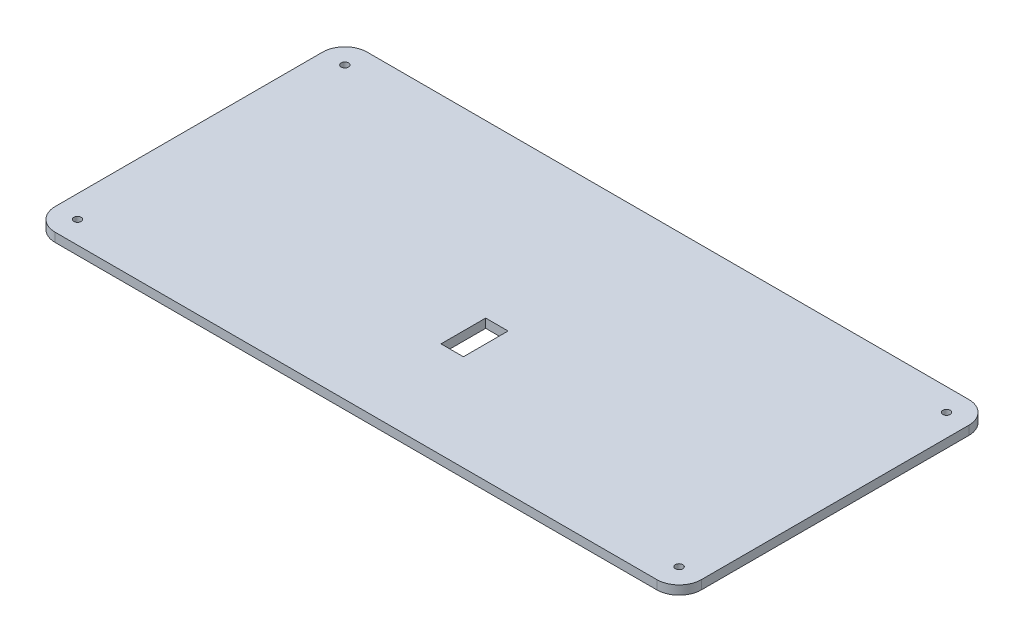
from build123d import *

# Parameters (mm, degrees)
SKETCH1_R               = 1.65
BOSS_EXTRUDE1_DEPTH     = 4
MIRROR2_COPY_1_SKETCH_R = 1.65
MIRROR2_COPY_1_DEPTH    = 4
MIRROR2_COPY_2_SKETCH_R = 1.65
MIRROR2_COPY_2_DEPTH    = 4
SKETCH2_W               = 10.05
SKETCH2_H               = 20.05
CUT_EXTRUDE5_DEPTH      = 162.062099825


with BuildPart() as part:
    # Sketch1 → Boss-Extrude1 (new body)
    with BuildSketch(Plane(origin=(0, 0, 0), x_dir=(1, 0, 0), z_dir=(0, 1, 0))):
        with BuildLine():
            Line((145, -60), (145, 0))
            Line((145, 0), (0, 0))
            Line((0, 0), (0, -70))
            Line((0, -70), (135, -70))
            ThreePointArc((135, -70), (142.071067812, -67.071067812), (145, -60))
        make_face()
        with Locations((135, -60)):
            Circle(SKETCH1_R, mode=Mode.SUBTRACT)
    boss_extrude1 = extrude(amount=BOSS_EXTRUDE1_DEPTH)

    # Mirror1: Boss-Extrude1 across plane
    add(boss_extrude1.mirror(Plane(origin=(0, 0, 0), x_dir=(0, 0, 1), z_dir=(1, 0, 0))))

    # Mirror2 copy 1 sketch → Mirror2 copy 1 (add)
    with BuildSketch(Plane(origin=(0, 0, 0), x_dir=(-1, 0, 0), z_dir=(0, 1, 0))):
        with BuildLine():
            Line((145, -60), (145, 0))
            Line((145, 0), (0, 0))
            Line((0, 0), (0, -70))
            Line((0, -70), (135, -70))
            ThreePointArc((135, -70), (142.071067812, -67.071067812), (145, -60))
        make_face()
        with Locations((135, -60)):
            Circle(MIRROR2_COPY_1_SKETCH_R, mode=Mode.SUBTRACT)
    extrude(amount=MIRROR2_COPY_1_DEPTH)

    # Mirror2 copy 2 sketch → Mirror2 copy 2 (add)
    with BuildSketch(Plane(origin=(0, 0, 0), x_dir=(1, 0, 0), z_dir=(0, 1, 0))):
        with BuildLine():
            Line((145, 60), (145, 0))
            Line((145, 0), (0, 0))
            Line((0, 0), (0, 70))
            Line((0, 70), (135, 70))
            ThreePointArc((135, 70), (142.071067812, 67.071067812), (145, 60))
        make_face()
        with Locations((135, 60)):
            Circle(MIRROR2_COPY_2_SKETCH_R, mode=Mode.SUBTRACT)
    extrude(amount=MIRROR2_COPY_2_DEPTH)

    # Sketch2 → Cut-Extrude5 (cut, through all)
    with BuildSketch(Plane(origin=(0, 4, 0), x_dir=(1, 0, 0), z_dir=(0, 1, 0))):
        with Locations((-0.025, -16.784138883)):
            Rectangle(SKETCH2_W, SKETCH2_H)
    extrude(amount=-CUT_EXTRUDE5_DEPTH, mode=Mode.SUBTRACT)


solid = part.part
